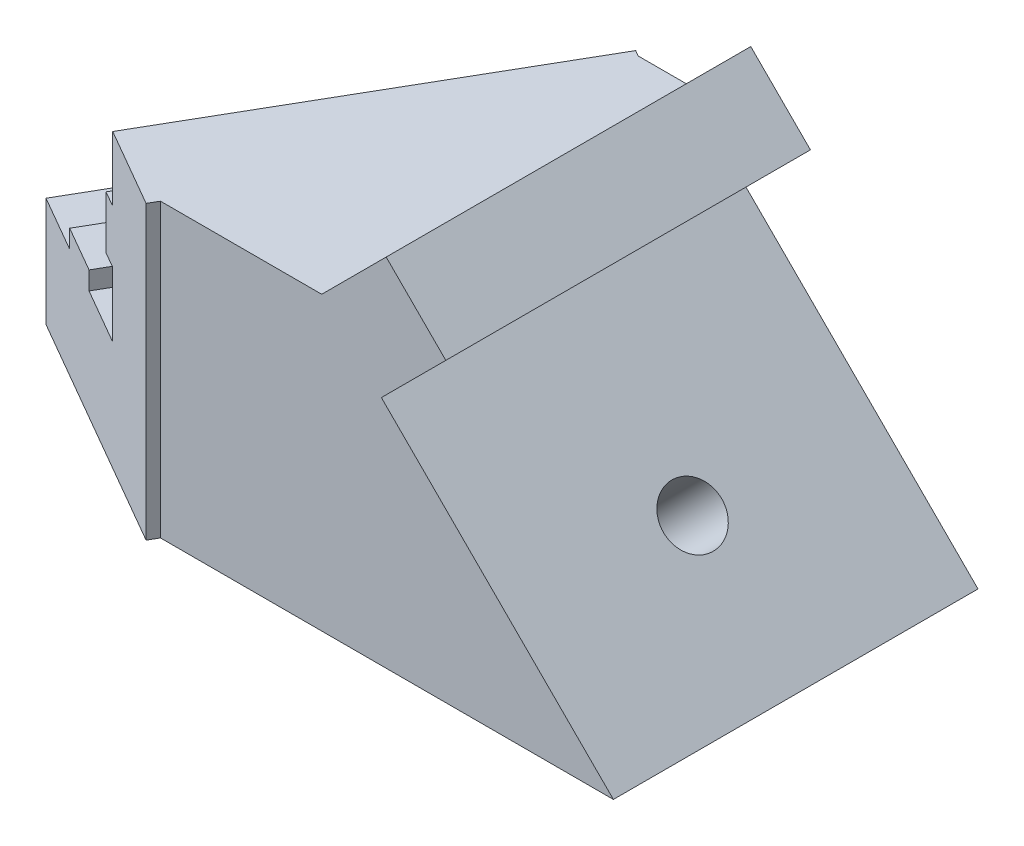
from build123d import *

# Parameters (mm, degrees)
BOSS_EXTRU_1_DEPTH      = 20
ESQUISSE2_R             = 1.6
ENL_V_MAT_EXTRU_1_DEPTH = 28.166155414
ESQUISSE3_R             = 4.25
ENL_V_MAT_EXTRU_2_DEPTH = 28.622454634
ESQUISSE4_W             = 22.287049145
ESQUISSE4_H             = 34.815979295
ENL_V_MAT_EXTRU_3_DEPTH = 6
BOSS_EXTRU_3_DEPTH      = 21
ESQUISSE6_W             = 20
ESQUISSE6_H             = 4.627416998
BOSS_EXTRU_4_DEPTH      = 5
ESQUISSE7_R             = 1.6
ENL_V_MAT_EXTRU_4_DEPTH = 36.403242935


with BuildPart() as part:
    # Esquisse1 → Boss.-Extru.1 (new body)
    with BuildSketch(Plane.XY):
        Polygon((10, 16), (26, 0), (0, 0), (0, 16), align=None)
    extrude(amount=BOSS_EXTRU_1_DEPTH)

    # Esquisse2 → Enlèv. mat.-Extru.1 (cut, through all)
    with BuildSketch(Plane(origin=(13, 13, 0), x_dir=(0, 0, -1), z_dir=(0.7071067811865487, 0.7071067811865465, 0))):
        with Locations((-10, -10.384776311)):
            Circle(ESQUISSE2_R)
    extrude(amount=-ENL_V_MAT_EXTRU_1_DEPTH, mode=Mode.SUBTRACT)

    # Esquisse3 → Enlèv. mat.-Extru.2 (cut, through all)
    with BuildSketch(Plane(origin=(9.464466094, 9.464466094, 0), x_dir=(0, 0, -1), z_dir=(0.7071067811865487, 0.7071067811865465, 0))):
        with Locations((-10, -10.384776311)):
            Circle(ESQUISSE3_R)
    extrude(amount=-ENL_V_MAT_EXTRU_2_DEPTH, mode=Mode.SUBTRACT)

    # Esquisse4 → Enlèv. mat.-Extru.3 (cut)
    with BuildSketch(Plane(origin=(0, 0, 0), x_dir=(0, -1, 0), z_dir=(-0.8660254037844398, 0, -0.499999999999998))):
        with Locations((-6.644134867, 0.407683814)):
            Rectangle(ESQUISSE4_W, ESQUISSE4_H)
    extrude(amount=-ENL_V_MAT_EXTRU_3_DEPTH, mode=Mode.SUBTRACT)

    # Esquisse5 → Boss.-Extru.3 (add)
    with BuildSketch(Plane(origin=(-3.464101615, 0, 18), x_dir=(-0.8660254037844398, 0, -0.49999999999999806), z_dir=(0.499999999999998, 0, -0.8660254037844397))):
        Polygon((-5, 0), (10, 0), (10, 6), (6.45, 6), (6.45, 7), (3.55, 7), (3.55, 6), (0, 6), (0, 9.55), (1, 9.55), (1, 12.45), (0, 12.45), (0, 16), (-5, 16), align=None)
    extrude(amount=BOSS_EXTRU_3_DEPTH)

    # Esquisse6 → Boss.-Extru.4 (add)
    with BuildSketch(Plane(origin=(13, 13, 0), x_dir=(0, 0, -1), z_dir=(0.7071067811865487, 0.7071067811865465, 0))):
        with Locations((-10, 1.928932188)):
            Rectangle(ESQUISSE6_W, ESQUISSE6_H)
    extrude(amount=BOSS_EXTRU_4_DEPTH)

    # Esquisse7 → Enlèv. mat.-Extru.4 (cut, through all)
    with BuildSketch(Plane(origin=(0, 7, 0), x_dir=(1, 0, 0), z_dir=(0, 1, 0))):
        with Locations((-2.294228634, -5.973720558)):
            Circle(ESQUISSE7_R)
    extrude(amount=-ENL_V_MAT_EXTRU_4_DEPTH, mode=Mode.SUBTRACT)


solid = part.part
